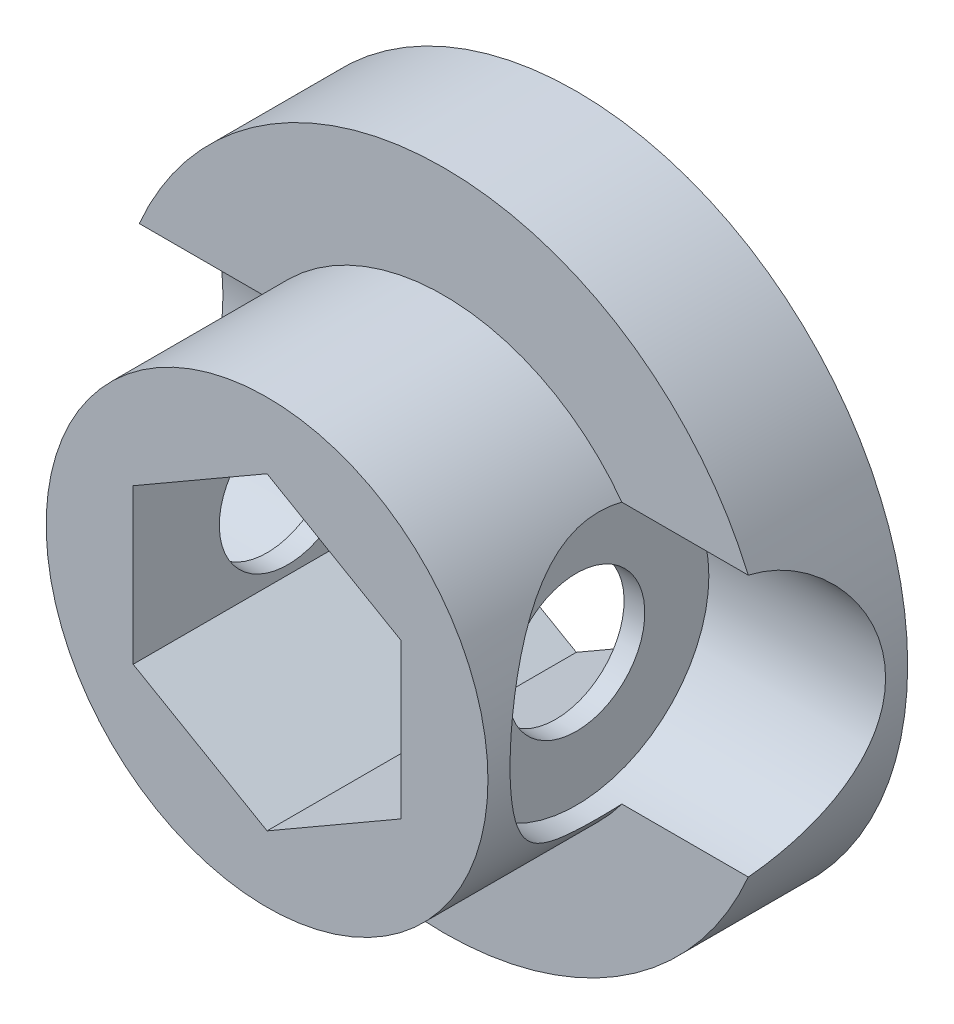
from build123d import *

# Parameters (mm, degrees)
SKETCH1_R               = 5
BOSS_EXTRUDE2_DEPTH     = 7
SKETCH3_R               = 7.5
SKETCH3_R_2             = 5
BOSS_EXTRUDE3_DEPTH     = 3
CUT_EXTRUDE1_DEPTH      = 5
CUT_EXTRUDE1_DEPTH_BACK = 5
SKETCH2_R               = 1.55
SKETCH4_R               = 3
CUT_EXTRUDE2_DEPTH      = 4
CUT_EXTRUDE3_START      = -4
SKETCH5_R               = 3
CUT_EXTRUDE3_DEPTH      = 4


with BuildPart() as part:
    # Sketch1 → Boss-Extrude2 (new body)
    with BuildSketch(Plane.XY):
        Circle(SKETCH1_R)
        Polygon((-3.031088913, 1.75), (0, 3.5), (3.031088913, 1.75), (3.031088913, -1.75), (0, -3.5), (-3.031088913, -1.75), align=None, mode=Mode.SUBTRACT)
    extrude(amount=BOSS_EXTRUDE2_DEPTH)

    # Sketch3 → Boss-Extrude3 (add)
    with BuildSketch(Plane.XY):
        Circle(SKETCH3_R)
        Circle(SKETCH3_R_2, mode=Mode.SUBTRACT)
    extrude(amount=BOSS_EXTRUDE3_DEPTH)

    # Sketch2 → Cut-Extrude1 (cut, two sides: drawn at the far end of the back side and taken through both)
    with BuildSketch(Plane.ZY.offset(-CUT_EXTRUDE1_DEPTH_BACK)):
        with Locations((3.5, 0)):
            Circle(SKETCH2_R)
    extrude(amount=CUT_EXTRUDE1_DEPTH + CUT_EXTRUDE1_DEPTH_BACK, mode=Mode.SUBTRACT)

    # Sketch4 → Cut-Extrude2 (cut)
    with BuildSketch(Plane.ZY.offset(3.5)):
        with Locations((3.5, 0)):
            Circle(SKETCH4_R)
    extrude(amount=CUT_EXTRUDE2_DEPTH, mode=Mode.SUBTRACT)

    # Sketch5 → Cut-Extrude3 (cut)
    with BuildSketch(Plane.ZY.offset(-3.5).offset(CUT_EXTRUDE3_START)):
        with Locations((3.5, 0)):
            Circle(SKETCH5_R)
    extrude(amount=CUT_EXTRUDE3_DEPTH, mode=Mode.SUBTRACT)


solid = part.part
